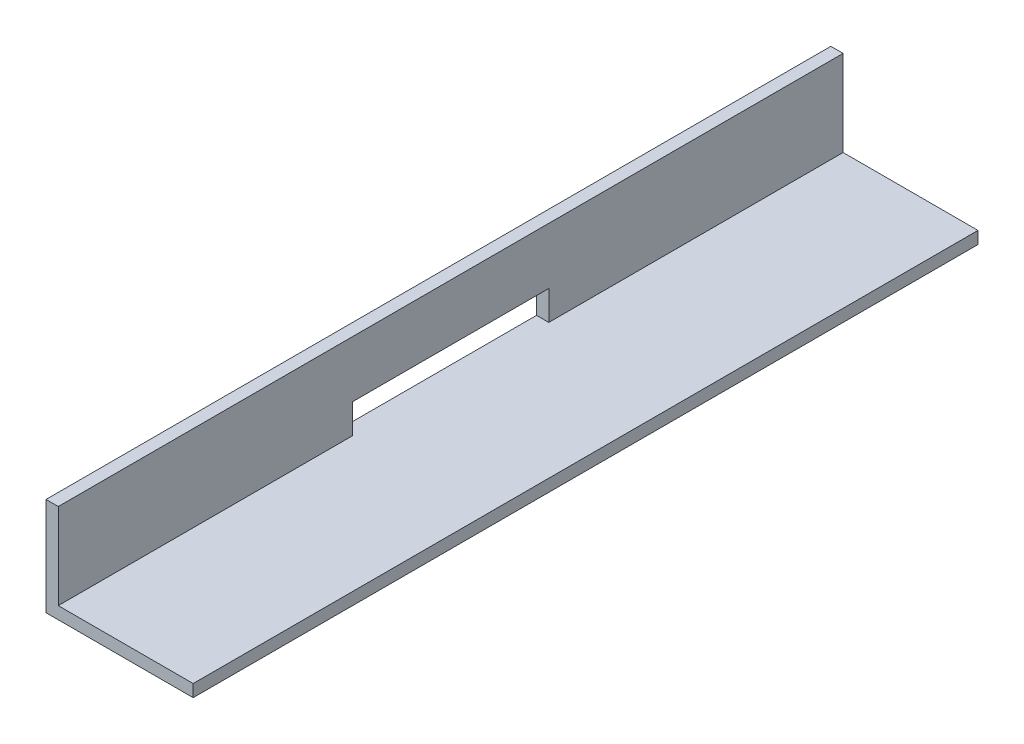
from build123d import *

# Parameters (mm, degrees)
BOSS_EXTRUDE1_DEPTH = 101.6
SKETCH4_W           = 25.4
SKETCH4_H           = 3.81
CUT_EXTRUDE1_DEPTH  = 2.54


with BuildPart() as part:
    # Sketch3 → Boss-Extrude1 (new body)
    with BuildSketch(Plane.XY):
        Polygon((0, 0), (19.05, 0), (19.05, 1.5875), (1.5875, 1.5875), (1.5875, 12.7), (0, 12.7), align=None)
    extrude(amount=BOSS_EXTRUDE1_DEPTH)

    # Sketch4 → Cut-Extrude1 (cut)
    with BuildSketch(Plane(origin=(1.5875, 0, 0), x_dir=(0, 0, -1), z_dir=(1, 0, 0))):
        with Locations((-50.8, 3.4925)):
            Rectangle(SKETCH4_W, SKETCH4_H)
    extrude(amount=-CUT_EXTRUDE1_DEPTH, mode=Mode.SUBTRACT)


solid = part.part
